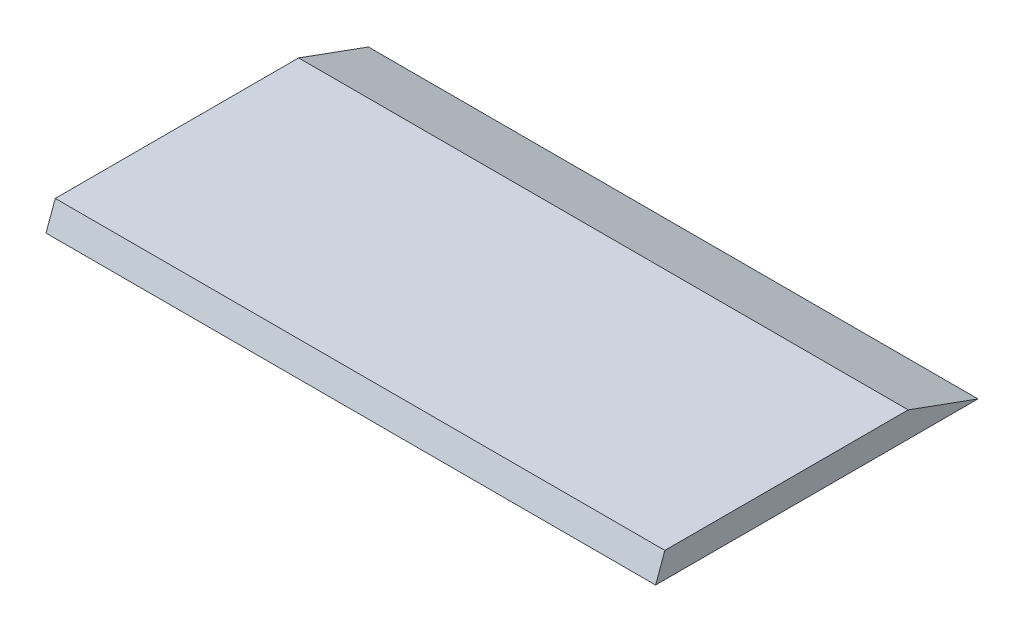
from build123d import *

# Parameters (mm, degrees)
SKETCH1_W           = 240
SKETCH1_H           = 126.92
BOSS_EXTRUDE1_DEPTH = 10
CHAMFER1_SIZE2      = 27.474774195
CHAMFER1_SIZE       = 10
CHAMFER3_SIZE2      = 10
CHAMFER3_SIZE       = 3.639702343


with BuildPart() as part:
    # Sketch1 → Boss-Extrude1 (new body)
    with BuildSketch(Plane(origin=(0, 0, 0), x_dir=(1, 0, 0), z_dir=(0, 1, 0))):
        with Locations((120, 63.46)):
            Rectangle(SKETCH1_W, SKETCH1_H)
    extrude(amount=BOSS_EXTRUDE1_DEPTH)

    # Chamfer1
    chamfer1_edges = [part.edges().sort_by_distance(p)[0] for p in [
        (120, 10, -126.92),
    ]]
    chamfer1_side = [part.faces().sort_by_distance(p)[0] for p in [
        (120, 9.8, -126.92),
    ]]
    chamfer(chamfer1_edges, length=CHAMFER1_SIZE - 0.0001, length2=CHAMFER1_SIZE2 - 0.0001, reference=chamfer1_side[0])  # a hair under: the kernel refuses the full size

    # Chamfer3
    chamfer3_edges = [part.edges().sort_by_distance(p)[0] for p in [
        (120, 10, 0),
    ]]
    chamfer3_side = [part.faces().sort_by_distance(p)[0] for p in [
        (120, 10, -0.072794047),
    ]]
    chamfer(chamfer3_edges, length=CHAMFER3_SIZE - 0.0001, length2=CHAMFER3_SIZE2 - 0.0001, reference=chamfer3_side[0])  # a hair under: the kernel refuses the full size


solid = part.part
